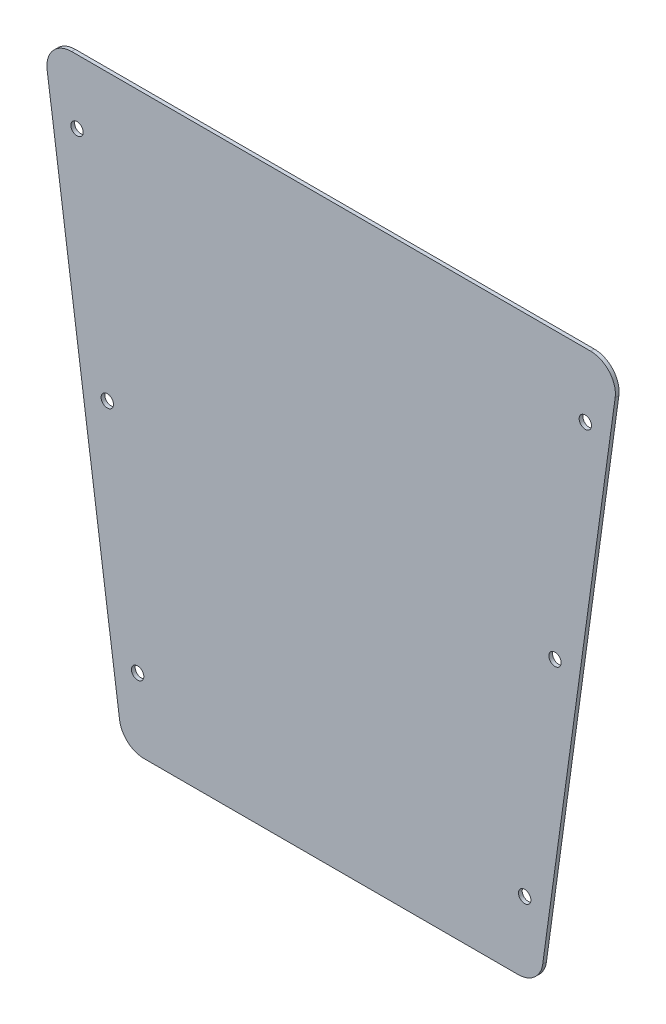
from build123d import *

# Parameters (mm, degrees)
BASE_FLANGE1_DEPTH = 1.5
FILLET1_R          = 10
SKETCH6_R          = 2.5
CUT_EXTRUDE1_DEPTH = 10


# Sheet-metal steps are written as plain solids
with BuildPart() as part:
    # Sketch1 → Base-Flange1 (new body)
    with BuildSketch(Plane.XY):
        Polygon((116.381309109, -54.730517105), (-116.381309109, -54.730517105), (-84.350299428, -287.658470614), (84.350299428, -287.658470614), align=None)
    extrude(amount=-BASE_FLANGE1_DEPTH)

    # Fillet1
    fillet1_edges = [part.edges().sort_by_distance(p)[0] for p in [
        (84.350299428, -287.658470614, -0.75),
        (-84.350299428, -287.658470614, -0.75),
        (-116.381309109, -54.730517105, -0.75),
        (116.381309109, -54.730517105, -0.75),
    ]]
    fillet(fillet1_edges, radius=FILLET1_R)

    # Sketch6 → Cut-Extrude1 (cut)
    with BuildSketch(Plane(origin=(0, 0, -1.5), x_dir=(-1, 0, 0), z_dir=(0, 0, -1))):
        with Locations((-102.757991697, -80.676477358)):
            Circle(SKETCH6_R)
        with Locations((-90.497057702, -169.837396474)):
            Circle(SKETCH6_R)
        with Locations((-78.236123708, -258.99831559)):
            Circle(SKETCH6_R)
        with Locations((102.722754997, -80.671631795)):
            Circle(SKETCH6_R)
        with Locations((90.497057702, -169.837396474)):
            Circle(SKETCH6_R)
        with Locations((78.236123708, -258.99831559)):
            Circle(SKETCH6_R)
    extrude(amount=-CUT_EXTRUDE1_DEPTH, mode=Mode.SUBTRACT)


solid = part.part
